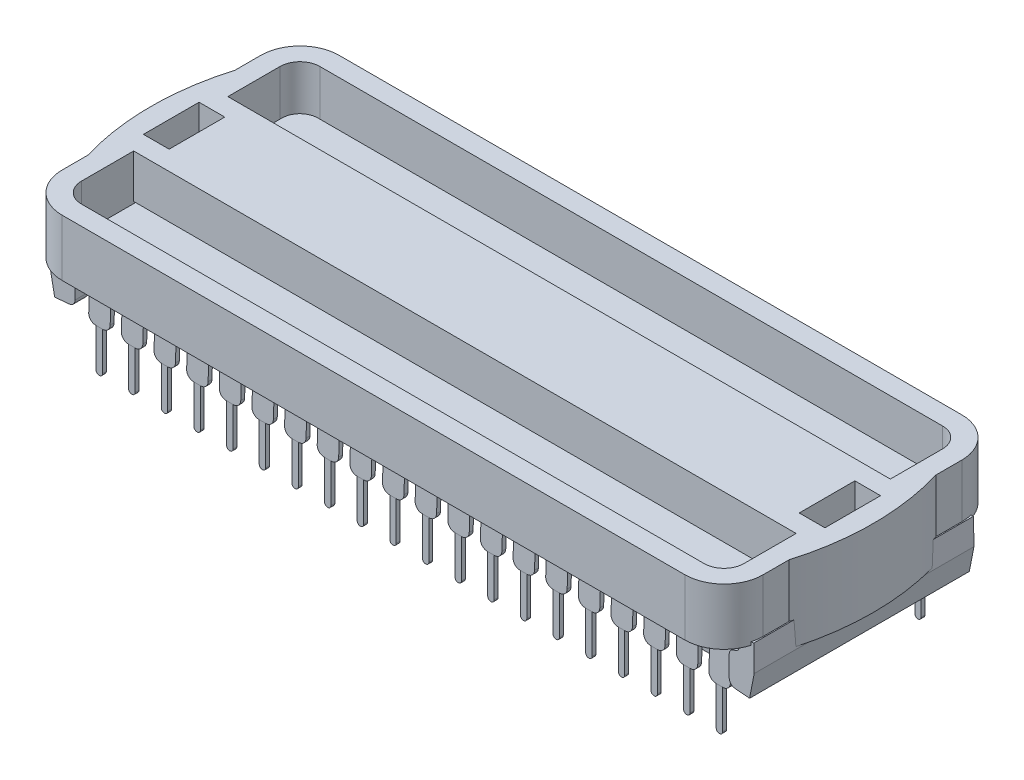
from build123d import *

# Parameters (mm, degrees)
SKETCH1_W                     = 52.32
SKETCH1_H                     = 14.75
BOSS_EXTRUDE1_DEPTH           = 1.875
BOSS_EXTRUDE1_TAPER           = 6
BOSS_EXTRUDE1_OTHER_WAY_DEPTH = 1.875
BOSS_EXTRUDE1_OTHER_WAY_TAPER = 6
SKETCH2_R                     = 0.625
CUT_EXTRUDE1_DEPTH            = 0.35
FILLET1_SIZE                  = 0.35
FILLET1_SIZE_2                = 0.5
SKETCH3_W                     = 9.425447068
SKETCH3_H                     = 1.192626765
SKETCH3_H_2                   = 1.192626766
CUT_EXTRUDE2_DEPTH            = 0.75
BOSS_EXTRUDE2_DEPTH           = 1.67
CUT_EXTRUDE3_DEPTH            = 1.67
LPATTERN1_COUNT               = 20
LPATTERN1_PITCH               = 2.54
PCB_DEPTH                     = 0.8
BOSS_EXTRUDE8_DEPTH           = 1
BOSS_EXTRUDE10_DEPTH          = 1.4
BOSS_EXTRUDE13_DEPTH          = 7.55
BOSS_EXTRUDE13_DEPTH_BACK     = 7.55
BOSS_EXTRUDE13_2_DEPTH        = 7.55
BOSS_EXTRUDE13_2_DEPTH_BACK   = 7.55
CUT_EXTRUDE4_DEPTH            = 0.15
CUT_EXTRUDE4_DEPTH_BACK       = 0.5
BOSS_EXTRUDE15_DEPTH          = 1
BOSS_EXTRUDE16_START          = -15.1
BOSS_EXTRUDE16_DEPTH          = 1
CUT_EXTRUDE5_DEPTH            = 0.35
BOSS_EXTRUDE17_DEPTH          = 2
BOSS_EXTRUDE19_DEPTH          = 6
BOSS_EXTRUDE20_START          = -7.33
BOSS_EXTRUDE20_DEPTH          = 7.33
SKETCH32_W                    = 2
SKETCH32_H                    = 4.33
CUT_EXTRUDE6_DEPTH            = 3


# Read off the part's stored shape, not the designer's step: Boss-Extrude20
with BuildPart() as part:
    # Sketch1 → Boss-Extrude1 (new body)
    with BuildSketch(Plane(origin=(0, 0, 0), x_dir=(1, 0, 0), z_dir=(0, 1, 0))):
        Rectangle(SKETCH1_W, SKETCH1_H)
    extrude(amount=BOSS_EXTRUDE1_DEPTH, taper=BOSS_EXTRUDE1_TAPER)

    # Sketch1 → Boss-Extrude1 other way (add)
    with BuildSketch(Plane(origin=(0, 0, 0), x_dir=(1, 0, 0), z_dir=(0, 1, 0))):
        Rectangle(SKETCH1_W, SKETCH1_H)
    extrude(amount=-BOSS_EXTRUDE1_OTHER_WAY_DEPTH, taper=BOSS_EXTRUDE1_OTHER_WAY_TAPER)

    # Sketch2 → Cut-Extrude1 (cut)
    with BuildSketch(Plane(origin=(0, 1.875, 0), x_dir=(1, 0, 0), z_dir=(0, 1, 0))):
        with Locations(Location((24.337929559, 5.552929559, 0), (0, 0, 270))):
            Circle(SKETCH2_R)
    extrude(amount=-CUT_EXTRUDE1_DEPTH, mode=Mode.SUBTRACT)

    # Fillet1
    # an asymmetric fillet: 0.5, 0.35 mm, written as the material it adds along each edge
    with BuildSketch(Plane(origin=(24.337929559, 1.525, -5.552929559), x_dir=(0, 0, 1), z_dir=(-1, 0, 0))) as fillet1_piece_1:
        with BuildLine():
            Bezier((0.625, FILLET1_SIZE), (0.625, 0), (0.625 - FILLET1_SIZE_2, 0), weights=[1, 0.707106781, 1])
            Line((0.625 - FILLET1_SIZE_2, 0), (0.625, 0))
            Line((0.625, 0), (0.625, FILLET1_SIZE))
        make_face()
    revolve(axis=Axis((24.337929559, 1.525, -5.552929559), (0, 1, 0)))

    # Sketch3 → Cut-Extrude2 (cut)
    with BuildSketch(Plane(origin=(0, 1.875, 0), x_dir=(1, 0, 0), z_dir=(0, 1, 0))):
        with Locations((30.675653093, 0.528686618)):
            Rectangle(SKETCH3_W, SKETCH3_H)
        with Locations((30.675653093, -0.663940148)):
            Rectangle(SKETCH3_W, SKETCH3_H_2)
        with BuildLine():
            Line((25.962929559, -0.067626765), (24.839964011, -0.067626765))
            ThreePointArc((24.839964011, -0.067626765), (25.143873666, -0.906468445), (25.962929559, -1.260253531))
            Line((25.962929559, -1.260253531), (25.962929559, -0.067626765))
        make_face()
        with BuildLine():
            Line((25.962929559, -0.067626765), (25.962929559, 1.125))
            ThreePointArc((25.962929559, 1.125), (25.143873666, 0.771214915), (24.839964011, -0.067626765))
            Line((24.839964011, -0.067626765), (25.962929559, -0.067626765))
        make_face()
    extrude(amount=-CUT_EXTRUDE2_DEPTH, mode=Mode.SUBTRACT)


with BuildPart() as body_2:
    # Sketch5 → Boss-Extrude2 (new body)
    with BuildSketch(Plane(origin=(0, 0, 0), x_dir=(0, 0, -1), z_dir=(1, 0, 0))):
        with BuildLine():
            Line((6.590230819, 0.15), (7.532975883, 0.15))
            ThreePointArc((7.532975883, 0.15), (7.706864121, 0.079618709), (7.78284453, -0.091896954))
            Line((7.78284453, -0.091896954), (7.875, -2.933638636))
            Line((7.875, -2.933638636), (7.875, -6.183638636))
            Line((7.875, -6.183638636), (7.575, -6.183638636))
            Line((7.575, -6.183638636), (7.575, -2.938501741))
            Line((7.575, -2.938501741), (7.486139966, -0.198379391))
            ThreePointArc((7.486139966, -0.198379391), (7.470943884, -0.164076258), (7.436166236, -0.15))
            Line((7.436166236, -0.15), (6.590230819, -0.15))
            Line((6.590230819, -0.15), (6.590230819, 0.15))
        make_face()
    extrude(amount=BOSS_EXTRUDE2_DEPTH)

    # Sketch6 → Cut-Extrude3 (cut)
    with BuildSketch(Plane(origin=(0, 0, -7.875), x_dir=(-1, 0, 0), z_dir=(0, 0, -1))):
        with BuildLine():
            Line((-1.085, -2.933638636), (-1.085, -5.938638636))
            ThreePointArc((-1.085, -5.938638636), (-1.013241161, -6.111879797), (-0.84, -6.183638636))
            Line((-0.84, -6.183638636), (-0.83, -6.183638636))
            ThreePointArc((-0.83, -6.183638636), (-0.656758839, -6.111879797), (-0.585, -5.938638636))
            Line((-0.585, -5.938638636), (-0.585, -2.933638636))
            Line((-0.585, -2.933638636), (-0.55, -2.933638636))
            ThreePointArc((-0.55, -2.933638636), (-0.16109127, -2.772547365), (0, -2.383638636))
            Line((0, -2.383638636), (0, -0.091896954))
            Line((0, -0.091896954), (1.792240485, -0.091896954))
            Line((1.792240485, -0.091896954), (1.792240485, -6.637804987))
            Line((1.792240485, -6.637804987), (-3.564600504, -6.637804987))
            Line((-3.564600504, -6.637804987), (-3.564600504, -0.091896954))
            Line((-3.564600504, -0.091896954), (-1.67, -0.091896954))
            Line((-1.67, -0.091896954), (-1.67, -2.383638636))
            ThreePointArc((-1.67, -2.383638636), (-1.50890873, -2.772547365), (-1.12, -2.933638636))
            Line((-1.12, -2.933638636), (-1.085, -2.933638636))
        make_face()
    extrude(amount=-CUT_EXTRUDE3_DEPTH, mode=Mode.SUBTRACT)


with BuildPart() as body_2_1:
    # Body-Move/Copy1: moved
    add(body_2.part.moved(Location((23.18, 0, 0))))


with BuildPart() as lpattern1_1:
    # LPattern1: pattern copy
    add(body_2_1.part.moved(Location(Vector(-1, 0, 0) * (1 * LPATTERN1_PITCH))))


with BuildPart() as lpattern1_2:
    # LPattern1: pattern copy
    add(body_2_1.part.moved(Location(Vector(-1, 0, 0) * (2 * LPATTERN1_PITCH))))


with BuildPart() as lpattern1_3:
    # LPattern1: pattern copy
    add(body_2_1.part.moved(Location(Vector(-1, 0, 0) * (3 * LPATTERN1_PITCH))))


with BuildPart() as lpattern1_4:
    # LPattern1: pattern copy
    add(body_2_1.part.moved(Location(Vector(-1, 0, 0) * (4 * LPATTERN1_PITCH))))


with BuildPart() as lpattern1_5:
    # LPattern1: pattern copy
    add(body_2_1.part.moved(Location(Vector(-1, 0, 0) * (5 * LPATTERN1_PITCH))))


with BuildPart() as lpattern1_6:
    # LPattern1: pattern copy
    add(body_2_1.part.moved(Location(Vector(-1, 0, 0) * (6 * LPATTERN1_PITCH))))


with BuildPart() as lpattern1_7:
    # LPattern1: pattern copy
    add(body_2_1.part.moved(Location(Vector(-1, 0, 0) * (7 * LPATTERN1_PITCH))))


with BuildPart() as lpattern1_8:
    # LPattern1: pattern copy
    add(body_2_1.part.moved(Location(Vector(-1, 0, 0) * (8 * LPATTERN1_PITCH))))


with BuildPart() as lpattern1_9:
    # LPattern1: pattern copy
    add(body_2_1.part.moved(Location(Vector(-1, 0, 0) * (9 * LPATTERN1_PITCH))))


with BuildPart() as lpattern1_10:
    # LPattern1: pattern copy
    add(body_2_1.part.moved(Location(Vector(-1, 0, 0) * (10 * LPATTERN1_PITCH))))


with BuildPart() as lpattern1_11:
    # LPattern1: pattern copy
    add(body_2_1.part.moved(Location(Vector(-1, 0, 0) * (11 * LPATTERN1_PITCH))))


with BuildPart() as lpattern1_12:
    # LPattern1: pattern copy
    add(body_2_1.part.moved(Location(Vector(-1, 0, 0) * (12 * LPATTERN1_PITCH))))


with BuildPart() as lpattern1_13:
    # LPattern1: pattern copy
    add(body_2_1.part.moved(Location(Vector(-1, 0, 0) * (13 * LPATTERN1_PITCH))))


with BuildPart() as lpattern1_14:
    # LPattern1: pattern copy
    add(body_2_1.part.moved(Location(Vector(-1, 0, 0) * (14 * LPATTERN1_PITCH))))


with BuildPart() as lpattern1_15:
    # LPattern1: pattern copy
    add(body_2_1.part.moved(Location(Vector(-1, 0, 0) * (15 * LPATTERN1_PITCH))))


with BuildPart() as lpattern1_16:
    # LPattern1: pattern copy
    add(body_2_1.part.moved(Location(Vector(-1, 0, 0) * (16 * LPATTERN1_PITCH))))


with BuildPart() as lpattern1_17:
    # LPattern1: pattern copy
    add(body_2_1.part.moved(Location(Vector(-1, 0, 0) * (17 * LPATTERN1_PITCH))))


with BuildPart() as lpattern1_18:
    # LPattern1: pattern copy
    add(body_2_1.part.moved(Location(Vector(-1, 0, 0) * (18 * LPATTERN1_PITCH))))


with BuildPart() as lpattern1_19:
    # LPattern1: pattern copy
    add(body_2_1.part.moved(Location(Vector(-1, 0, 0) * (19 * LPATTERN1_PITCH))))


with BuildPart() as body_22:
    # Mirror3: mirrored copy
    add(lpattern1_1.part.mirror(Plane.XY))


with BuildPart() as body_23:
    # Mirror3 2: mirrored copy
    add(lpattern1_19.part.mirror(Plane.XY))


with BuildPart() as body_24:
    # Mirror3 3: mirrored copy
    add(lpattern1_18.part.mirror(Plane.XY))


with BuildPart() as body_25:
    # Mirror3 4: mirrored copy
    add(lpattern1_17.part.mirror(Plane.XY))


with BuildPart() as body_26:
    # Mirror3 5: mirrored copy
    add(lpattern1_16.part.mirror(Plane.XY))


with BuildPart() as body_27:
    # Mirror3 6: mirrored copy
    add(lpattern1_15.part.mirror(Plane.XY))


with BuildPart() as body_28:
    # Mirror3 7: mirrored copy
    add(lpattern1_14.part.mirror(Plane.XY))


with BuildPart() as body_29:
    # Mirror3 8: mirrored copy
    add(lpattern1_13.part.mirror(Plane.XY))


with BuildPart() as body_30:
    # Mirror3 9: mirrored copy
    add(lpattern1_12.part.mirror(Plane.XY))


with BuildPart() as body_31:
    # Mirror3 10: mirrored copy
    add(lpattern1_11.part.mirror(Plane.XY))


with BuildPart() as body_32:
    # Mirror3 11: mirrored copy
    add(lpattern1_10.part.mirror(Plane.XY))


with BuildPart() as body_33:
    # Mirror3 12: mirrored copy
    add(lpattern1_9.part.mirror(Plane.XY))


with BuildPart() as body_34:
    # Mirror3 13: mirrored copy
    add(lpattern1_8.part.mirror(Plane.XY))


with BuildPart() as body_35:
    # Mirror3 14: mirrored copy
    add(lpattern1_7.part.mirror(Plane.XY))


with BuildPart() as body_36:
    # Mirror3 15: mirrored copy
    add(lpattern1_6.part.mirror(Plane.XY))


with BuildPart() as body_37:
    # Mirror3 16: mirrored copy
    add(lpattern1_5.part.mirror(Plane.XY))


with BuildPart() as body_38:
    # Mirror3 17: mirrored copy
    add(lpattern1_4.part.mirror(Plane.XY))


with BuildPart() as body_39:
    # Mirror3 18: mirrored copy
    add(lpattern1_3.part.mirror(Plane.XY))


with BuildPart() as body_40:
    # Mirror3 19: mirrored copy
    add(lpattern1_2.part.mirror(Plane.XY))


with BuildPart() as body_41:
    # Mirror3 20: mirrored copy
    add(body_2_1.part.mirror(Plane.XY))


with BuildPart() as lpattern1_15_1:
    add(lpattern1_15.part)

    # Combine1: union body 24, LPattern1_17, body 34, part, LPattern1_19, LPattern1_2, body 31, body 2, body 41, LPattern1_4, LPattern1_6, body 28, body 38, LPattern1_8, body 25, LPattern1_10, body 35, LPattern1_12, body 22, body 32, LPattern1_14, LPattern1_16, body 29, body 39, LPattern1_18, LPattern1_1, body 26, LPattern1_3, body 36, LPattern1_5, body 23, body 33, LPattern1_7, LPattern1_9, body 30, body 40, LPattern1_11, LPattern1_13, body 27, body 37
    add(body_24.part)
    add(lpattern1_17.part)
    add(body_34.part)
    add(part.part)
    add(lpattern1_19.part)
    add(lpattern1_2.part)
    add(body_31.part)
    add(body_2_1.part)
    add(body_41.part)
    add(lpattern1_4.part)
    add(lpattern1_6.part)
    add(body_28.part)
    add(body_38.part)
    add(lpattern1_8.part)
    add(body_25.part)
    add(lpattern1_10.part)
    add(body_35.part)
    add(lpattern1_12.part)
    add(body_22.part)
    add(body_32.part)
    add(lpattern1_14.part)
    add(lpattern1_16.part)
    add(body_29.part)
    add(body_39.part)
    add(lpattern1_18.part)
    add(lpattern1_1.part)
    add(body_26.part)
    add(lpattern1_3.part)
    add(body_36.part)
    add(lpattern1_5.part)
    add(body_23.part)
    add(body_33.part)
    add(lpattern1_7.part)
    add(lpattern1_9.part)
    add(body_30.part)
    add(body_40.part)
    add(lpattern1_11.part)
    add(lpattern1_13.part)
    add(body_27.part)
    add(body_37.part)


with BuildPart() as body_2_2:
    # Sketch15 → PCB (new body)
    with BuildSketch(Plane(origin=(0, 1.875, 0), x_dir=(1, 0, 0), z_dir=(0, 1, 0))):
        with BuildLine():
            Line((-24.228, 9.125), (24.228, 9.125))
            ThreePointArc((24.228, 9.125), (25.215828173, 8.715828173), (25.625, 7.728))
            Line((25.625, 7.728), (25.625, 2.1))
            Line((25.625, 2.1), (23.625, 2.1))
            Line((23.625, 2.1), (23.625, -2.1))
            Line((23.625, -2.1), (25.625, -2.1))
            Line((25.625, -2.1), (25.625, -7.728))
            ThreePointArc((25.625, -7.728), (25.215828173, -8.715828173), (24.228, -9.125))
            Line((24.228, -9.125), (-24.228, -9.125))
            ThreePointArc((-24.228, -9.125), (-25.215828173, -8.715828173), (-25.625, -7.728))
            Line((-25.625, -7.728), (-25.625, -2.1))
            Line((-25.625, -2.1), (-23.625, -2.1))
            Line((-23.625, -2.1), (-23.625, 2.1))
            Line((-23.625, 2.1), (-25.625, 2.1))
            Line((-25.625, 2.1), (-25.625, 7.728))
            ThreePointArc((-25.625, 7.728), (-25.215828173, 8.715828173), (-24.228, 9.125))
        make_face()
    extrude(amount=PCB_DEPTH)


with BuildPart() as body_3:
    # Sketch17 → Boss-Extrude8 (new body)
    with BuildSketch(Plane(origin=(0, 2.675, 0), x_dir=(1, 0, 0), z_dir=(0, 1, 0))):
        with BuildLine():
            Line((-27.275, 0.45), (-27.275, -0.45))
            Line((-27.275, -0.45), (-27.275, -7.728))
            ThreePointArc((-27.275, -7.728), (-26.382554362, -9.882554362), (-24.228, -10.775))
            Line((-24.228, -10.775), (24.228, -10.775))
            ThreePointArc((24.228, -10.775), (26.382554362, -9.882554362), (27.275, -7.728))
            Line((27.275, -7.728), (27.275, -0.45))
            Line((27.275, -0.45), (27.275, 0.45))
            Line((27.275, 0.45), (27.275, 7.728))
            ThreePointArc((27.275, 7.728), (26.382554362, 9.882554362), (24.228, 10.775))
            Line((24.228, 10.775), (-24.228, 10.775))
            ThreePointArc((-24.228, 10.775), (-26.382554362, 9.882554362), (-27.275, 7.728))
            Line((-27.275, 7.728), (-27.275, 0.45))
        make_face()
        with BuildLine():
            Line((23.775, 1.95), (25.775, 1.95))
            Line((25.775, 1.95), (25.775, 7.728))
            ThreePointArc((25.775, 7.728), (25.32189419, 8.82189419), (24.228, 9.275))
            Line((24.228, 9.275), (-24.228, 9.275))
            ThreePointArc((-24.228, 9.275), (-25.32189419, 8.82189419), (-25.775, 7.728))
            Line((-25.775, 7.728), (-25.775, 1.95))
            Line((-25.775, 1.95), (-23.775, 1.95))
            Line((-23.775, 1.95), (-23.775, -1.95))
            Line((-23.775, -1.95), (-25.775, -1.95))
            Line((-25.775, -1.95), (-25.775, -7.728))
            ThreePointArc((-25.775, -7.728), (-25.32189419, -8.82189419), (-24.228, -9.275))
            Line((-24.228, -9.275), (24.228, -9.275))
            ThreePointArc((24.228, -9.275), (25.32189419, -8.82189419), (25.775, -7.728))
            Line((25.775, -7.728), (25.775, -1.95))
            Line((25.775, -1.95), (23.775, -1.95))
            Line((23.775, -1.95), (23.775, 1.95))
        make_face(mode=Mode.SUBTRACT)
    extrude(amount=-BOSS_EXTRUDE8_DEPTH)

    # Sketch18 → Boss-Extrude10 (add)
    with BuildSketch(Plane(origin=(0, 2.675, 0), x_dir=(1, 0, 0), z_dir=(0, 1, 0))):
        with BuildLine():
            ThreePointArc((24.228, -10.775), (26.382554362, -9.882554362), (27.275, -7.728))
            Line((27.275, -7.728), (27.275, 7.728))
            ThreePointArc((27.275, 7.728), (26.382554362, 9.882554362), (24.228, 10.775))
            Line((24.228, 10.775), (-24.228, 10.775))
            ThreePointArc((-24.228, 10.775), (-26.382554362, 9.882554362), (-27.275, 7.728))
            Line((-27.275, 7.728), (-27.275, -7.728))
            ThreePointArc((-27.275, -7.728), (-26.382554362, -9.882554362), (-24.228, -10.775))
            Line((-24.228, -10.775), (24.228, -10.775))
        make_face()
        with BuildLine():
            Line((-25.775, -3.665), (25.775, -3.665))
            Line((25.775, -3.665), (25.775, -7.728))
            ThreePointArc((25.775, -7.728), (25.32189419, -8.82189419), (24.228, -9.275))
            Line((24.228, -9.275), (-24.228, -9.275))
            ThreePointArc((-24.228, -9.275), (-25.32189419, -8.82189419), (-25.775, -7.728))
            Line((-25.775, -7.728), (-25.775, -3.665))
        make_face(mode=Mode.SUBTRACT)
        with BuildLine():
            Line((25.775, 3.665), (-25.775, 3.665))
            Line((-25.775, 3.665), (-25.775, 7.728))
            ThreePointArc((-25.775, 7.728), (-25.32189419, 8.82189419), (-24.228, 9.275))
            Line((-24.228, 9.275), (24.228, 9.275))
            ThreePointArc((24.228, 9.275), (25.32189419, 8.82189419), (25.775, 7.728))
            Line((25.775, 7.728), (25.775, 3.665))
        make_face(mode=Mode.SUBTRACT)
    extrude(amount=BOSS_EXTRUDE10_DEPTH)

    # Sketch24 → Cut-Extrude4 (cut, two sides: drawn at the far end of the back side and taken through both)
    with BuildSketch(Plane(origin=(0, 1.875, 0), x_dir=(1, 0, 0), z_dir=(0, 1, 0)).offset(-CUT_EXTRUDE4_DEPTH_BACK)):
        with BuildLine():
            Line((26.212929559, 0.838525492), (26.212929559, 7.427929559))
            Line((26.212929559, 7.427929559), (-26.212929559, 7.427929559))
            Line((-26.212929559, 7.427929559), (-26.212929559, -7.427929559))
            Line((-26.212929559, -7.427929559), (26.212929559, -7.427929559))
            Line((26.212929559, -7.427929559), (26.212929559, -0.973779022))
            ThreePointArc((26.212929559, -0.973779022), (25.413276903, -0.816066983), (25.090546833, -0.067626765))
            ThreePointArc((25.090546833, -0.067626765), (25.413276903, 0.680813453), (26.212929559, 0.838525492))
        make_face()
    extrude(amount=CUT_EXTRUDE4_DEPTH + CUT_EXTRUDE4_DEPTH_BACK, mode=Mode.SUBTRACT)



with BuildPart() as body_4:
    # Sketch20 → Boss-Extrude13 (new, two sides: drawn at the far end of the back side and taken through both)
    with BuildSketch(Plane.XY.offset(-BOSS_EXTRUDE13_DEPTH_BACK)):
        with BuildLine():
            Line((-27.396856444, -0.110962015), (-27.037118897, -1.961651253))
            Line((-27.037118897, -1.961651253), (-25.937249928, -1.865425187))
            Line((-25.937249928, -1.865425187), (-25.885184578, -1.860870059))
            ThreePointArc((-25.885184578, -1.860870059), (-25.687480031, -1.567761014), (-25.980589076, -1.370056467))
            Line((-25.980589076, -1.370056467), (-26.244922124, -0.010180821))
            Line((-26.244922124, -0.010180821), (-26.211560033, 1.901132116))
            Line((-26.211560033, 1.901132116), (-27.361384882, 1.921202383))
            Line((-27.361384882, 1.921202383), (-27.396856444, -0.110962015))
        make_face()
    extrude(amount=BOSS_EXTRUDE13_DEPTH + BOSS_EXTRUDE13_DEPTH_BACK)


with BuildPart() as body_5:
    # Sketch20 → Boss-Extrude13 2 (new, two sides: drawn at the far end of the back side and taken through both)
    with BuildSketch(Plane.XY.offset(-BOSS_EXTRUDE13_2_DEPTH_BACK)):
        with BuildLine():
            Line((27.396856444, -0.110962015), (27.361384882, 1.921202383))
            Line((27.361384882, 1.921202383), (26.211560033, 1.901132116))
            Line((26.211560033, 1.901132116), (26.244922124, -0.010180821))
            Line((26.244922124, -0.010180821), (25.980589076, -1.370056467))
            ThreePointArc((25.980589076, -1.370056467), (25.687480031, -1.567761014), (25.885184578, -1.860870059))
            Line((25.885184578, -1.860870059), (25.937249928, -1.865425187))
            Line((25.937249928, -1.865425187), (27.037118897, -1.961651253))
            Line((27.037118897, -1.961651253), (27.396856444, -0.110962015))
        make_face()
    extrude(amount=BOSS_EXTRUDE13_2_DEPTH + BOSS_EXTRUDE13_2_DEPTH_BACK)


with BuildPart() as body_3_1:
    add(body_3.part)

    add(body_4.part)  # Boss-Extrude15 merges body 4

    add(body_5.part)  # Boss-Extrude15 merges body 5
    # Sketch25 → Boss-Extrude15 (add)
    with BuildSketch(Plane.XY.offset(7.55)):
        with BuildLine():
            Line((-25.950450989, 0.70377046), (-25.845769249, 0.70377046))
            ThreePointArc((-25.845769249, 0.70377046), (-26.11680442, 0.817424939), (-26.225711373, 1.090402374))
            Line((-26.225711373, 1.090402374), (-26.244922124, -0.010180821))
            Line((-26.244922124, -0.010180821), (-25.980589076, -1.370056467))
            ThreePointArc((-25.980589076, -1.370056467), (-25.688167227, -1.564352427), (-25.878377292, -1.859448325))
            ThreePointArc((-25.878377292, -1.859448325), (-25.572273221, -1.691750592), (-25.450450989, -1.364670211))
            Line((-25.450450989, -1.364670211), (-25.450450989, 0.20377046))
            ThreePointArc((-25.450450989, 0.20377046), (-25.596897599, 0.55732385), (-25.950450989, 0.70377046))
        make_face()
        with BuildLine():
            Line((-26.244922124, -0.010180821), (-26.225711373, 1.090402374))
            Line((-26.225711373, 1.090402374), (-26.211560033, 1.901132116))
            Line((-26.211560033, 1.901132116), (-27.361384882, 1.921202383))
            Line((-27.361384882, 1.921202383), (-27.396856444, -0.110962015))
            Line((-27.396856444, -0.110962015), (-27.037118897, -1.961651253))
            Line((-27.037118897, -1.961651253), (-25.906873118, -1.86276756))
            ThreePointArc((-25.906873118, -1.86276756), (-25.892601394, -1.86131236), (-25.878377292, -1.859448325))
            ThreePointArc((-25.878377292, -1.859448325), (-25.688167227, -1.564352427), (-25.980589076, -1.370056467))
            Line((-25.980589076, -1.370056467), (-26.244922124, -0.010180821))
        make_face()
        with BuildLine():
            ThreePointArc((-25.885184578, -1.860870059), (-25.881775991, -1.860182863), (-25.878377292, -1.859448325))
            ThreePointArc((-25.878377292, -1.859448325), (-25.892601394, -1.86131236), (-25.906873118, -1.86276756))
            Line((-25.906873118, -1.86276756), (-25.885184578, -1.860870059))
        make_face()
        with BuildLine():
            Line((27.037118897, -1.961651253), (27.396856444, -0.110962015))
            Line((27.396856444, -0.110962015), (27.361384882, 1.921202383))
            Line((27.361384882, 1.921202383), (26.211560033, 1.901132116))
            Line((26.211560033, 1.901132116), (26.225711373, 1.090402374))
            ThreePointArc((26.225711373, 1.090402374), (26.11680442, 0.817424939), (25.845769249, 0.70377046))
            Line((25.845769249, 0.70377046), (25.950450989, 0.70377046))
            ThreePointArc((25.950450989, 0.70377046), (25.596897599, 0.55732385), (25.450450989, 0.20377046))
            Line((25.450450989, 0.20377046), (25.450450989, -1.364670211))
            ThreePointArc((25.450450989, -1.364670211), (25.581812321, -1.702465315), (25.906873118, -1.86276756))
            Line((25.906873118, -1.86276756), (27.037118897, -1.961651253))
        make_face()
    extrude(amount=BOSS_EXTRUDE15_DEPTH)

    # Sketch25<3> → Boss-Extrude16 (add)
    with BuildSketch(Plane.XY.offset(7.55).offset(BOSS_EXTRUDE16_START)):
        with BuildLine():
            Line((-25.950450989, 0.70377046), (-25.845769249, 0.70377046))
            ThreePointArc((-25.845769249, 0.70377046), (-26.11680442, 0.817424939), (-26.225711373, 1.090402374))
            Line((-26.225711373, 1.090402374), (-26.244922124, -0.010180821))
            Line((-26.244922124, -0.010180821), (-25.980589076, -1.370056467))
            ThreePointArc((-25.980589076, -1.370056467), (-25.688167227, -1.564352427), (-25.878377292, -1.859448325))
            ThreePointArc((-25.878377292, -1.859448325), (-25.572273221, -1.691750592), (-25.450450989, -1.364670211))
            Line((-25.450450989, -1.364670211), (-25.450450989, 0.20377046))
            ThreePointArc((-25.450450989, 0.20377046), (-25.596897599, 0.55732385), (-25.950450989, 0.70377046))
        make_face()
        with BuildLine():
            Line((-26.244922124, -0.010180821), (-26.225711373, 1.090402374))
            Line((-26.225711373, 1.090402374), (-26.211560033, 1.901132116))
            Line((-26.211560033, 1.901132116), (-27.361384882, 1.921202383))
            Line((-27.361384882, 1.921202383), (-27.396856444, -0.110962015))
            Line((-27.396856444, -0.110962015), (-27.037118897, -1.961651253))
            Line((-27.037118897, -1.961651253), (-25.906873118, -1.86276756))
            ThreePointArc((-25.906873118, -1.86276756), (-25.892601394, -1.86131236), (-25.878377292, -1.859448325))
            ThreePointArc((-25.878377292, -1.859448325), (-25.688167227, -1.564352427), (-25.980589076, -1.370056467))
            Line((-25.980589076, -1.370056467), (-26.244922124, -0.010180821))
        make_face()
        with BuildLine():
            ThreePointArc((-25.885184578, -1.860870059), (-25.881775991, -1.860182863), (-25.878377292, -1.859448325))
            ThreePointArc((-25.878377292, -1.859448325), (-25.892601394, -1.86131236), (-25.906873118, -1.86276756))
            Line((-25.906873118, -1.86276756), (-25.885184578, -1.860870059))
        make_face()
        with BuildLine():
            Line((27.037118897, -1.961651253), (27.396856444, -0.110962015))
            Line((27.396856444, -0.110962015), (27.361384882, 1.921202383))
            Line((27.361384882, 1.921202383), (26.211560033, 1.901132116))
            Line((26.211560033, 1.901132116), (26.225711373, 1.090402374))
            ThreePointArc((26.225711373, 1.090402374), (26.11680442, 0.817424939), (25.845769249, 0.70377046))
            Line((25.845769249, 0.70377046), (25.950450989, 0.70377046))
            ThreePointArc((25.950450989, 0.70377046), (25.596897599, 0.55732385), (25.450450989, 0.20377046))
            Line((25.450450989, 0.20377046), (25.450450989, -1.364670211))
            ThreePointArc((25.450450989, -1.364670211), (25.581812321, -1.702465315), (25.906873118, -1.86276756))
            Line((25.906873118, -1.86276756), (27.037118897, -1.961651253))
        make_face()
    extrude(amount=-BOSS_EXTRUDE16_DEPTH)

    # Sketch26 → Cut-Extrude5 (cut)
    with BuildSketch(Plane.XZ.offset(-1.675)):
        with BuildLine():
            Line((26.212929559, -0.838525492), (26.212929559, 0.973779022))
            ThreePointArc((26.212929559, 0.973779022), (25.413276903, 0.816066983), (25.090546833, 0.067626765))
            ThreePointArc((25.090546833, 0.067626765), (25.413276903, -0.680813453), (26.212929559, -0.838525492))
        make_face()
    extrude(amount=-CUT_EXTRUDE5_DEPTH, mode=Mode.SUBTRACT)

    # Sketch28 → Boss-Extrude17 (add)
    with BuildSketch(Plane(origin=(0, 4.075, 0), x_dir=(1, 0, 0), z_dir=(0, 1, 0))):
        with BuildLine():
            Line((27.275, -7.728), (27.275, 7.728))
            ThreePointArc((27.275, 7.728), (26.382554362, 9.882554362), (24.228, 10.775))
            Line((24.228, 10.775), (-24.228, 10.775))
            ThreePointArc((-24.228, 10.775), (-26.382554362, 9.882554362), (-27.275, 7.728))
            Line((-27.275, 7.728), (-27.275, -7.728))
            ThreePointArc((-27.275, -7.728), (-26.382554362, -9.882554362), (-24.228, -10.775))
            Line((-24.228, -10.775), (24.228, -10.775))
            ThreePointArc((24.228, -10.775), (26.382554362, -9.882554362), (27.275, -7.728))
        make_face()
        with BuildLine():
            Line((-25.775, -7.728), (-25.775, -3.665))
            Line((-25.775, -3.665), (25.775, -3.665))
            Line((25.775, -3.665), (25.775, -7.728))
            ThreePointArc((25.775, -7.728), (25.32189419, -8.82189419), (24.228, -9.275))
            Line((24.228, -9.275), (-24.228, -9.275))
            ThreePointArc((-24.228, -9.275), (-25.32189419, -8.82189419), (-25.775, -7.728))
        make_face(mode=Mode.SUBTRACT)
        with BuildLine():
            Line((25.775, 7.728), (25.775, 3.665))
            Line((25.775, 3.665), (-25.775, 3.665))
            Line((-25.775, 3.665), (-25.775, 7.728))
            ThreePointArc((-25.775, 7.728), (-25.32189419, 8.82189419), (-24.228, 9.275))
            Line((-24.228, 9.275), (24.228, 9.275))
            ThreePointArc((24.228, 9.275), (25.32189419, 8.82189419), (25.775, 7.728))
        make_face(mode=Mode.SUBTRACT)
    extrude(amount=BOSS_EXTRUDE17_DEPTH)

    # Sketch30 → Boss-Extrude19 (add)
    with BuildSketch(Plane(origin=(0, 6.075, 0), x_dir=(1, 0, 0), z_dir=(0, 1, 0))):
        with BuildLine():
            Line((-27.037595532, 6.464644283), (-26.244922124, 4.787429448))
            Line((-26.244922124, 4.787429448), (-26.244922124, -6.0137191))
            Line((-26.244922124, -6.0137191), (-26.797396909, -7.132478322))
            ThreePointArc((-26.797396909, -7.132478322), (-28.102937241, -0.35485831), (-27.037595532, 6.464644283))
        make_face()
        with BuildLine():
            Line((26.244922124, -6.0137191), (26.244922124, 4.787429448))
            Line((26.244922124, 4.787429448), (27.037595532, 6.464644283))
            ThreePointArc((27.037595532, 6.464644283), (28.102937241, -0.35485831), (26.797396909, -7.132478322))
            Line((26.797396909, -7.132478322), (26.244922124, -6.0137191))
        make_face()
    extrude(amount=-BOSS_EXTRUDE19_DEPTH)

    # Boss-Extrude20 outline → Boss-Extrude20 (add)
    with BuildSketch(Plane.XY.offset(3.665).offset(BOSS_EXTRUDE20_START)):
        with BuildLine():
            Line((20, 2.675), (-20, 2.675))
            ThreePointArc((-20, 2.675), (0, 2.175), (20, 2.675))
        make_face()
    extrude(amount=BOSS_EXTRUDE20_DEPTH)

    # Sketch32 → Cut-Extrude6 (cut)
    with BuildSketch(Plane(origin=(0, 6.075, 0), x_dir=(1, 0, 0), z_dir=(0, 1, 0))):
        with Locations((-25.515178598, 0)):
            Rectangle(SKETCH32_W, SKETCH32_H)
        with Locations((25.515178598, 0)):
            Rectangle(SKETCH32_W, SKETCH32_H)
    extrude(amount=-CUT_EXTRUDE6_DEPTH, mode=Mode.SUBTRACT)


solid = Compound([lpattern1_15_1.part, body_2_2.part, body_3_1.part])
